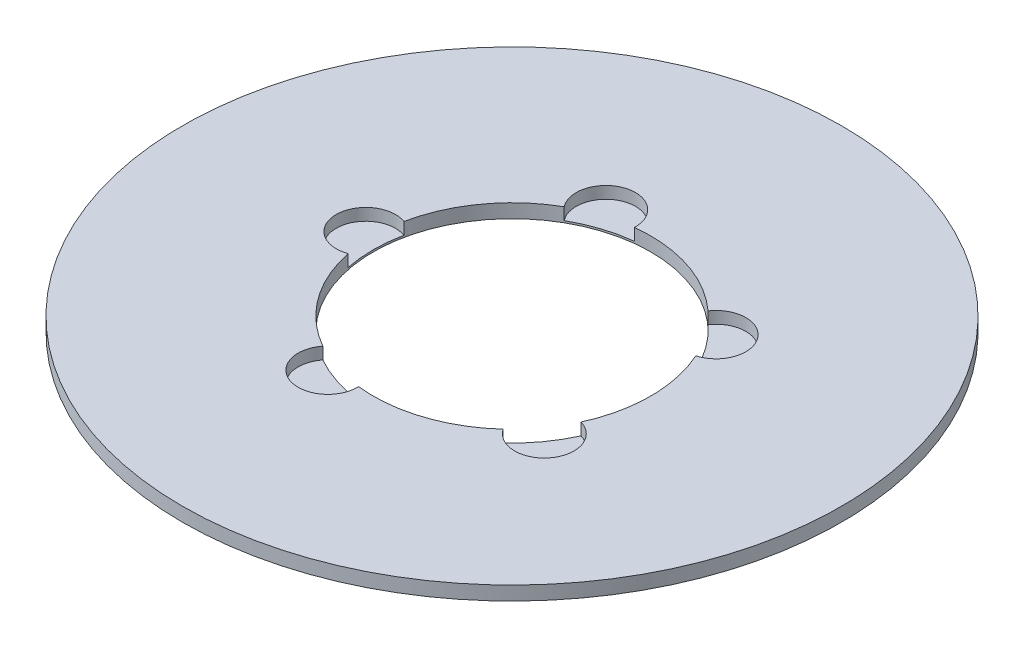
from build123d import *

# Parameters (mm, degrees)
SKETCH1_R           = 95
BOSS_EXTRUDE1_DEPTH = 4
SKETCH2_R           = 40
CUT_EXTRUDE1_DEPTH  = 135.40982107
SKETCH3_R           = 8.549663476
CUT_EXTRUDE2_DEPTH  = 3.453877945
CIRPATTERN1_COUNT   = 5


with BuildPart() as part:
    # Sketch1 → Boss-Extrude1 (new body)
    with BuildSketch(Plane(origin=(0, 0, 0), x_dir=(1, 0, 0), z_dir=(0, 1, 0))):
        Circle(SKETCH1_R)
    extrude(amount=BOSS_EXTRUDE1_DEPTH)

    # Sketch2 → Cut-Extrude1 (cut, through all)
    with BuildSketch(Plane(origin=(0, 0, 0), x_dir=(1, 0, 0), z_dir=(0, 1, 0))):
        Circle(SKETCH2_R)
    extrude(amount=CUT_EXTRUDE1_DEPTH, mode=Mode.SUBTRACT)

    # Sketch3 → Cut-Extrude2 (cut)
    with BuildSketch(Plane(origin=(0, 4, 0), x_dir=(1, 0, 0), z_dir=(0, 1, 0))):
        with Locations((-42.134798006, 0)):
            Circle(SKETCH3_R)
    cut_extrude2 = extrude(amount=-CUT_EXTRUDE2_DEPTH, mode=Mode.SUBTRACT)

    # CirPattern1: Cut-Extrude2 ×5 about axis
    cirpattern1_axis = Axis((0, 0, 0), (0, 1, 0))
    for i in range(1, CIRPATTERN1_COUNT):
        add(cut_extrude2.rotate(cirpattern1_axis, i * 360 / CIRPATTERN1_COUNT), mode=Mode.SUBTRACT)


solid = part.part
